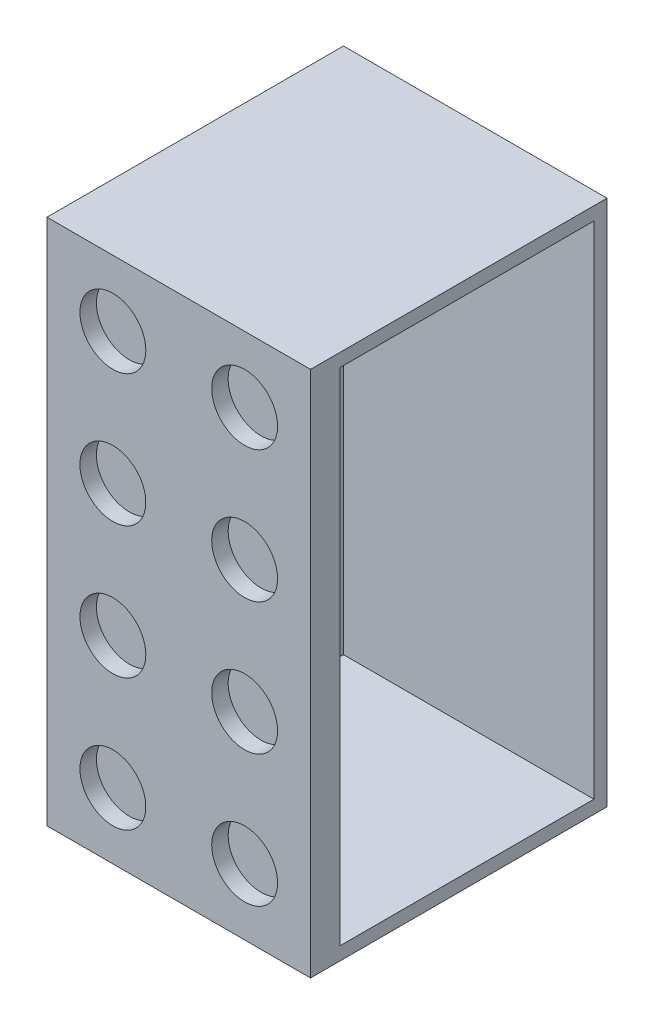
from build123d import *

# Parameters (mm, degrees)
SKETCH1_W           = 50.8
SKETCH1_H           = 101.6
BOSS_EXTRUDE1_DEPTH = 57.15
SKETCH3_R           = 6.35
SKETCH3_R_2         = 2.54
CUT_EXTRUDE2_DEPTH  = 3.175
SKETCH6_W           = 48.895
SKETCH6_H           = 96.52
CUT_EXTRUDE5_DEPTH  = 48.26


with BuildPart() as part:
    # Sketch1 → Boss-Extrude1 (new body)
    with BuildSketch(Plane.XY):
        with Locations((25.4, 50.8)):
            Rectangle(SKETCH1_W, SKETCH1_H)
    extrude(amount=BOSS_EXTRUDE1_DEPTH)

    # Sketch3 → Cut-Extrude2 (cut)
    with BuildSketch(Plane.XY.offset(57.15)):
        with Locations((12.7, 139.7)):
            Circle(SKETCH3_R)
        with Locations((38.1, 139.7)):
            Circle(SKETCH3_R)
        with Locations((63.5, 139.7)):
            Circle(SKETCH3_R_2)
        with Locations((88.9, 139.7)):
            Circle(SKETCH3_R_2)
        with Locations((88.9, 114.3)):
            Circle(SKETCH3_R_2)
        with Locations((63.5, 114.3)):
            Circle(SKETCH3_R_2)
        with Locations((38.1, 114.3)):
            Circle(SKETCH3_R)
        with Locations((12.7, 114.3)):
            Circle(SKETCH3_R)
        with Locations((88.9, 88.9)):
            Circle(SKETCH3_R_2)
        with Locations((63.5, 88.9)):
            Circle(SKETCH3_R_2)
        with Locations((38.1, 88.9)):
            Circle(SKETCH3_R)
        with Locations((12.7, 88.9)):
            Circle(SKETCH3_R)
        with Locations((88.9, 63.5)):
            Circle(SKETCH3_R_2)
        with Locations((63.5, 63.5)):
            Circle(SKETCH3_R_2)
        with Locations((38.1, 63.5)):
            Circle(SKETCH3_R)
        with Locations((12.7, 63.5)):
            Circle(SKETCH3_R)
        with Locations((88.9, 38.1)):
            Circle(SKETCH3_R_2)
        with Locations((63.5, 38.1)):
            Circle(SKETCH3_R_2)
        with Locations((38.1, 38.1)):
            Circle(SKETCH3_R)
        with Locations((12.7, 38.1)):
            Circle(SKETCH3_R)
        with Locations((88.9, 12.7)):
            Circle(SKETCH3_R_2)
        with Locations((63.5, 12.7)):
            Circle(SKETCH3_R_2)
        with Locations((38.1, 12.7)):
            Circle(SKETCH3_R)
        with Locations((12.7, 12.7)):
            Circle(SKETCH3_R)
    extrude(amount=-CUT_EXTRUDE2_DEPTH, mode=Mode.SUBTRACT)

    # Sketch6 → Cut-Extrude5 (cut)
    with BuildSketch(Plane(origin=(50.8, 0, 0), x_dir=(0, 0, -1), z_dir=(1, 0, 0))):
        with Locations((-26.9875, 50.8)):
            Rectangle(SKETCH6_W, SKETCH6_H)
    extrude(amount=-CUT_EXTRUDE5_DEPTH, mode=Mode.SUBTRACT)


solid = part.part
